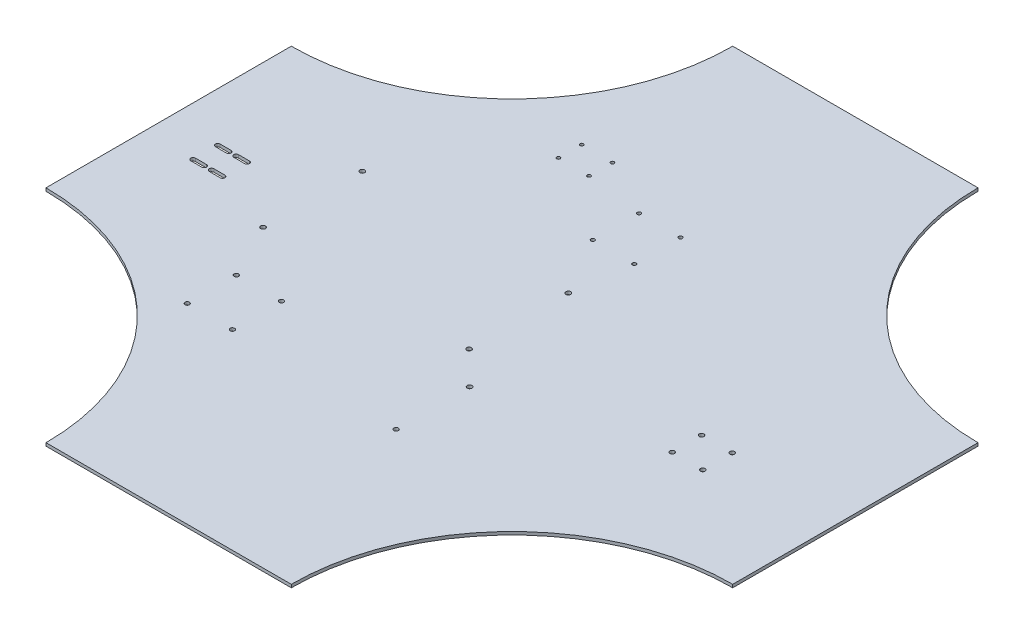
from build123d import *

# Parameters (mm, degrees)
BOSS_EXTRUDE1_DEPTH     = 3.175
CUT_EXTRUDE1_DEPTH      = 503.904365287
CUT_EXTRUDE1_DEPTH_BACK = 503.904365287
SKETCH4_R               = 2.413
CUT_EXTRUDE2_DEPTH      = 503.904365287
SKETCH5_R               = 2.5
SKETCH5_R_2             = 2.47796547
CUT_EXTRUDE3_DEPTH      = 503.904365287
SKETCH6_R               = 2.321781934
SKETCH6_R_2             = 2.346310539
SKETCH6_R_3             = 2.5
SKETCH6_R_4             = 1.905
SKETCH6_R_5             = 1.75
CUT_EXTRUDE4_DEPTH      = 503.904365287


with BuildPart() as part:
    # Sketch1 → Boss-Extrude1 (new body)
    with BuildSketch(Plane(origin=(0, 0, 0), x_dir=(1, 0, 0), z_dir=(0, 1, 0))):
        with BuildLine():
            Line((-127, -355.6), (127, -355.6))
            ThreePointArc((127, -355.6), (193.955389821, -193.955389821), (355.6, -127))
            Line((355.6, -127), (355.6, 127))
            ThreePointArc((355.6, 127), (193.955389821, 193.955389821), (127, 355.6))
            Line((127, 355.6), (-127, 355.6))
            ThreePointArc((-127, 355.6), (-193.955389821, 193.955389821), (-355.6, 127))
            Line((-355.6, 127), (-355.6, -127))
            ThreePointArc((-355.6, -127), (-193.955389821, -193.955389821), (-127, -355.6))
        make_face()
    extrude(amount=BOSS_EXTRUDE1_DEPTH)

    # Sketch2 → Cut-Extrude1 (cut, two sides: drawn at the far end of the back side and taken through both)
    with BuildSketch(Plane(origin=(0, 3.175, 0), x_dir=(1, 0, 0), z_dir=(0, 1, 0)).offset(-CUT_EXTRUDE1_DEPTH_BACK)):
        with BuildLine():
            Line((-304.8, 2.413), (-293.37, 2.413))
            ThreePointArc((-293.37, 2.413), (-290.957, 0), (-293.37, -2.413))
            Line((-293.37, -2.413), (-304.8, -2.413))
            ThreePointArc((-304.8, -2.413), (-307.213, 0), (-304.8, 2.413))
        make_face()
        with BuildLine():
            Line((-304.8, -22.987), (-293.37, -22.987))
            ThreePointArc((-293.37, -22.987), (-290.957, -25.4), (-293.37, -27.813))
            Line((-293.37, -27.813), (-304.8, -27.813))
            ThreePointArc((-304.8, -27.813), (-307.213, -25.4), (-304.8, -22.987))
        make_face()
        with BuildLine():
            Line((-285.75, -2.413), (-274.32, -2.413))
            ThreePointArc((-274.32, -2.413), (-271.907, 0), (-274.32, 2.413))
            Line((-274.32, 2.413), (-285.75, 2.413))
            ThreePointArc((-285.75, 2.413), (-288.163, 0), (-285.75, -2.413))
        make_face()
        with BuildLine():
            Line((-285.75, -22.987), (-274.32, -22.987))
            ThreePointArc((-274.32, -22.987), (-271.907, -25.4), (-274.32, -27.813))
            Line((-274.32, -27.813), (-285.75, -27.813))
            ThreePointArc((-285.75, -27.813), (-288.163, -25.4), (-285.75, -22.987))
        make_face()
    extrude(amount=CUT_EXTRUDE1_DEPTH + CUT_EXTRUDE1_DEPTH_BACK, mode=Mode.SUBTRACT)

    # Sketch4 → Cut-Extrude2 (cut, through all)
    with BuildSketch(Plane(origin=(0, 3.175, 0), x_dir=(1, 0, 0), z_dir=(0, 1, 0))):
        with Locations((237.49, -9.430177049)):
            Circle(SKETCH4_R)
        with Locations((205.74, -9.430177049)):
            Circle(SKETCH4_R)
        with Locations((237.49, -39.910177049)):
            Circle(SKETCH4_R)
        with Locations((205.74, -39.910177049)):
            Circle(SKETCH4_R)
    extrude(amount=-CUT_EXTRUDE2_DEPTH, mode=Mode.SUBTRACT)

    # Sketch5 → Cut-Extrude3 (cut, through all)
    with BuildSketch(Plane.XZ):
        with Locations((-207.790149601, 50.01656837)):
            Circle(SKETCH5_R)
        with Locations((-206.624048203, -51.576739518)):
            Circle(SKETCH5_R)
        with Locations((8.09562966, 52.494533839)):
            Circle(SKETCH5_R_2)
        with Locations((9.261731058, -49.098774048)):
            Circle(SKETCH5_R)
    extrude(amount=-CUT_EXTRUDE3_DEPTH, mode=Mode.SUBTRACT)

    # Sketch6 → Cut-Extrude4 (cut, through all)
    with BuildSketch(Plane.XZ):
        with Locations((-131.96570437, 157.594741445)):
            Circle(SKETCH6_R)
        with Locations((-131.96570437, 106.794741445)):
            Circle(SKETCH6_R)
        with Locations((-178.700591901, 106.794741445)):
            Circle(SKETCH6_R)
        with Locations((-178.700591901, 157.594741445)):
            Circle(SKETCH6_R)
        with Locations((42.265908941, 162.337536061)):
            Circle(SKETCH6_R_2)
        with Locations((42.265908941, 86.137536061)):
            Circle(SKETCH6_R_3)
        with Locations((17.371687145, -109.265722508)):
            Circle(SKETCH6_R_4)
        with Locations((-25.681149945, -109.384160374)):
            Circle(SKETCH6_R_4)
        with Locations((-25.549785233, -157.135979683)):
            Circle(SKETCH6_R_4)
        with Locations((17.503045383, -157.015188359)):
            Circle(SKETCH6_R_4)
        with Locations((-84.882409293, -188.871278488)):
            Circle(SKETCH6_R_5)
        with Locations((-85.091846145, -164.872192335)):
            Circle(SKETCH6_R_5)
        with Locations((-116.881190831, -189.150527624)):
            Circle(SKETCH6_R_5)
        with Locations((-117.090627683, -165.151441471)):
            Circle(SKETCH6_R_5)
    extrude(amount=-CUT_EXTRUDE4_DEPTH, mode=Mode.SUBTRACT)


solid = part.part
